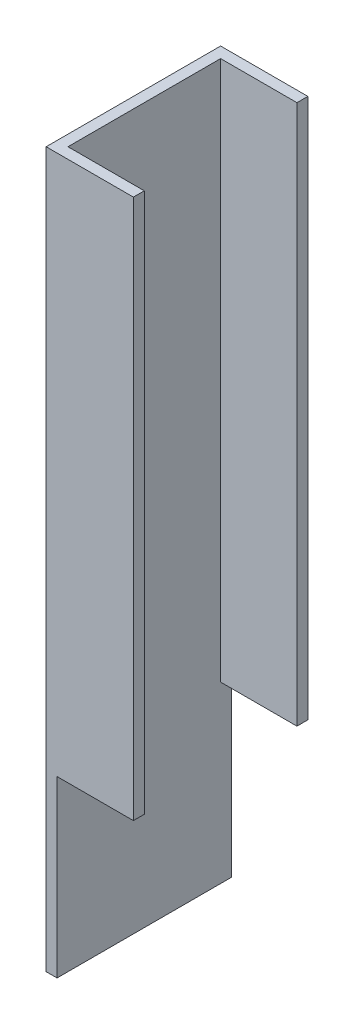
from build123d import *

# Parameters (mm, degrees)
BOSS_EXTRUDE1_DEPTH = 104.013
SKETCH2_W           = 22.225
SKETCH2_H           = 50.8
CUT_EXTRUDE1_DEPTH  = 208.026


with BuildPart() as part:
    # Sketch1 → Boss-Extrude1 (new, symmetric)
    with BuildSketch(Plane(origin=(0, 0, 0), x_dir=(1, 0, 0), z_dir=(0, 1, 0))):
        Polygon((-20.955, 0), (-20.955, 25.4), (4.445, 25.4), (4.445, 22.225), (-17.78, 22.225), (-17.78, -22.225), (4.445, -22.225), (4.445, -25.4), (-20.955, -25.4), align=None)
    extrude(amount=BOSS_EXTRUDE1_DEPTH, both=True)

    # Sketch2 → Cut-Extrude1 (cut)
    with BuildSketch(Plane.XY.offset(25.4)):
        with Locations((-6.6675, -78.613)):
            Rectangle(SKETCH2_W, SKETCH2_H)
    extrude(amount=-CUT_EXTRUDE1_DEPTH, mode=Mode.SUBTRACT)


solid = part.part
